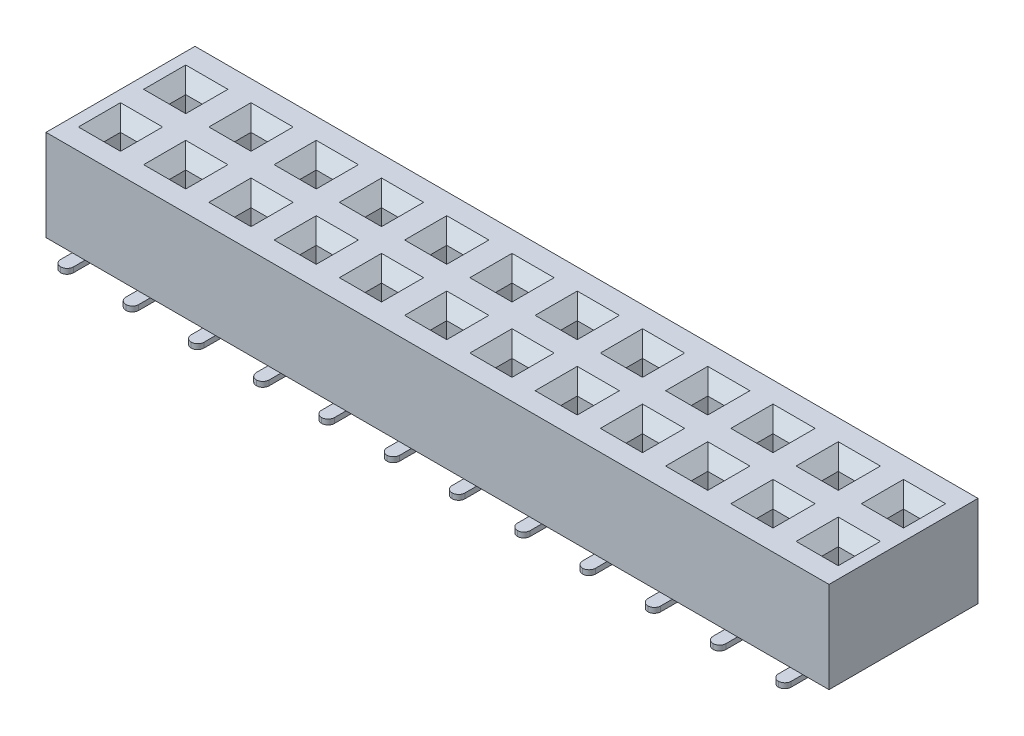
from build123d import *

# Parameters (mm, degrees)
SKETCH1_W                  = 30.48
SKETCH1_H                  = 5.8
BOSS_EXTRUDE1_DEPTH        = 3.55
SKETCH2_W                  = 0.64
SKETCH2_H                  = 0.64
CUT_EXTRUDE1_DEPTH         = 31.822765937
CHAMFER1_SIZE              = 0.5
LPATTERN1_COUNT            = 12
LPATTERN1_PITCH            = 2.54
LPATTERN1_COUNT_DIR2       = 2
LPATTERN1_PITCH_DIR2       = 2.54
CHAMFER1_OF_LPATTERN1_SIZE = 0.5
SKETCH3_W                  = 0.5
SKETCH3_H                  = 2.01
BOSS_EXTRUDE2_DEPTH        = 0.2
FILLET1_R                  = 0.25
LPATTERN2_COUNT            = 12
LPATTERN2_PITCH            = 2.54
FILLET1_OF_LPATTERN2_R     = 0.25


with BuildPart() as part:
    # Sketch1 → Boss-Extrude1 (new body)
    with BuildSketch(Plane(origin=(0, 0, 0), x_dir=(1, 0, 0), z_dir=(0, 1, 0))):
        with Locations((15.24, 0)):
            Rectangle(SKETCH1_W, SKETCH1_H)
    extrude(amount=BOSS_EXTRUDE1_DEPTH)

    # Sketch2 → Cut-Extrude1 (cut, through all)
    with BuildSketch(Plane(origin=(0, 3.55, 0), x_dir=(1, 0, 0), z_dir=(0, 1, 0))):
        with Locations((1.27, 1.27)):
            Rectangle(SKETCH2_W, SKETCH2_H)
    cut_extrude1 = extrude(amount=-CUT_EXTRUDE1_DEPTH, mode=Mode.SUBTRACT)

    # Chamfer1
    chamfer1_edges = [part.edges().sort_by_distance(p)[0] for p in [
        (0.95, 3.55, -1.27),
        (1.27, 3.55, -0.95),
        (1.59, 3.55, -1.27),
        (1.27, 3.55, -1.59),
    ]]
    chamfer(chamfer1_edges, length=CHAMFER1_SIZE)

    # LPattern1: Cut-Extrude1 12 × 2
    with Locations(*[(i * LPATTERN1_PITCH, 0, j * LPATTERN1_PITCH_DIR2) for i in range(LPATTERN1_COUNT) for j in range(LPATTERN1_COUNT_DIR2) if (i, j) != (0, 0)]):
        add(cut_extrude1, mode=Mode.SUBTRACT)

    # Chamfer1 of LPattern1
    chamfer1_of_lpattern1_edges = [part.edges().sort_by_distance(p)[0] for p in [
        (0.95, 3.55, 1.27),
        (1.27, 3.55, 1.59),
        (1.59, 3.55, 1.27),
        (1.27, 3.55, 0.95),
        (3.49, 3.55, -1.27),
        (3.81, 3.55, -0.95),
        (4.13, 3.55, -1.27),
        (3.81, 3.55, -1.59),
        (3.49, 3.55, 1.27),
        (3.81, 3.55, 1.59),
        (4.13, 3.55, 1.27),
        (3.81, 3.55, 0.95),
        (6.03, 3.55, -1.27),
        (6.35, 3.55, -0.95),
        (6.67, 3.55, -1.27),
        (6.35, 3.55, -1.59),
        (6.03, 3.55, 1.27),
        (6.35, 3.55, 1.59),
        (6.67, 3.55, 1.27),
        (6.35, 3.55, 0.95),
        (8.57, 3.55, -1.27),
        (8.89, 3.55, -0.95),
        (9.21, 3.55, -1.27),
        (8.89, 3.55, -1.59),
        (8.57, 3.55, 1.27),
        (8.89, 3.55, 1.59),
        (9.21, 3.55, 1.27),
        (8.89, 3.55, 0.95),
        (11.11, 3.55, -1.27),
        (11.43, 3.55, -0.95),
        (11.75, 3.55, -1.27),
        (11.43, 3.55, -1.59),
        (11.11, 3.55, 1.27),
        (11.43, 3.55, 1.59),
        (11.75, 3.55, 1.27),
        (11.43, 3.55, 0.95),
        (13.65, 3.55, -1.27),
        (13.97, 3.55, -0.95),
        (14.29, 3.55, -1.27),
        (13.97, 3.55, -1.59),
        (13.65, 3.55, 1.27),
        (13.97, 3.55, 1.59),
        (14.29, 3.55, 1.27),
        (13.97, 3.55, 0.95),
        (16.19, 3.55, -1.27),
        (16.51, 3.55, -0.95),
        (16.83, 3.55, -1.27),
        (16.51, 3.55, -1.59),
        (16.19, 3.55, 1.27),
        (16.51, 3.55, 1.59),
        (16.83, 3.55, 1.27),
        (16.51, 3.55, 0.95),
        (18.73, 3.55, -1.27),
        (19.05, 3.55, -0.95),
        (19.37, 3.55, -1.27),
        (19.05, 3.55, -1.59),
        (18.73, 3.55, 1.27),
        (19.05, 3.55, 1.59),
        (19.37, 3.55, 1.27),
        (19.05, 3.55, 0.95),
        (21.27, 3.55, -1.27),
        (21.59, 3.55, -0.95),
        (21.91, 3.55, -1.27),
        (21.59, 3.55, -1.59),
        (21.27, 3.55, 1.27),
        (21.59, 3.55, 1.59),
        (21.91, 3.55, 1.27),
        (21.59, 3.55, 0.95),
        (23.81, 3.55, -1.27),
        (24.13, 3.55, -0.95),
        (24.45, 3.55, -1.27),
        (24.13, 3.55, -1.59),
        (23.81, 3.55, 1.27),
        (24.13, 3.55, 1.59),
        (24.45, 3.55, 1.27),
        (24.13, 3.55, 0.95),
        (26.35, 3.55, -1.27),
        (26.67, 3.55, -0.95),
        (26.99, 3.55, -1.27),
        (26.67, 3.55, -1.59),
        (26.35, 3.55, 1.27),
        (26.67, 3.55, 1.59),
        (26.99, 3.55, 1.27),
        (26.67, 3.55, 0.95),
        (28.89, 3.55, -1.27),
        (29.21, 3.55, -0.95),
        (29.53, 3.55, -1.27),
        (29.21, 3.55, -1.59),
        (28.89, 3.55, 1.27),
        (29.21, 3.55, 1.59),
        (29.53, 3.55, 1.27),
        (29.21, 3.55, 0.95),
    ]]
    chamfer(chamfer1_of_lpattern1_edges, length=CHAMFER1_OF_LPATTERN1_SIZE)

    # Sketch3 → Boss-Extrude2 (add)
    with BuildSketch(Plane.XZ):
        with Locations((1.27, 2.595)):
            Rectangle(SKETCH3_W, SKETCH3_H)
        with Locations((1.27, -2.595)):
            Rectangle(SKETCH3_W, SKETCH3_H)
    boss_extrude2 = extrude(amount=BOSS_EXTRUDE2_DEPTH)

    # Fillet1
    fillet1_edges = [part.edges().sort_by_distance(p)[0] for p in [
        (1.02, -0.1, -3.6),
        (1.52, -0.1, -3.6),
        (1.02, -0.1, 3.6),
        (1.52, -0.1, 3.6),
    ]]
    fillet(fillet1_edges, radius=FILLET1_R - 0.0001)  # a hair under: the kernel refuses the full size

    # LPattern2: Boss-Extrude2 ×12
    with Locations(*[(i * LPATTERN2_PITCH, 0, 0) for i in range(1, LPATTERN2_COUNT)]):
        add(boss_extrude2)

    # Fillet1 of LPattern2
    fillet1_of_lpattern2_edges = [part.edges().sort_by_distance(p)[0] for p in [
        (3.56, -0.1, -3.6),
        (4.06, -0.1, -3.6),
        (3.56, -0.1, 3.6),
        (4.06, -0.1, 3.6),
        (6.1, -0.1, -3.6),
        (6.6, -0.1, -3.6),
        (6.1, -0.1, 3.6),
        (6.6, -0.1, 3.6),
        (8.64, -0.1, -3.6),
        (9.14, -0.1, -3.6),
        (8.64, -0.1, 3.6),
        (9.14, -0.1, 3.6),
        (11.18, -0.1, -3.6),
        (11.68, -0.1, -3.6),
        (11.18, -0.1, 3.6),
        (11.68, -0.1, 3.6),
        (13.72, -0.1, -3.6),
        (14.22, -0.1, -3.6),
        (13.72, -0.1, 3.6),
        (14.22, -0.1, 3.6),
        (16.26, -0.1, -3.6),
        (16.76, -0.1, -3.6),
        (16.26, -0.1, 3.6),
        (16.76, -0.1, 3.6),
        (18.8, -0.1, -3.6),
        (19.3, -0.1, -3.6),
        (18.8, -0.1, 3.6),
        (19.3, -0.1, 3.6),
        (21.34, -0.1, -3.6),
        (21.84, -0.1, -3.6),
        (21.34, -0.1, 3.6),
        (21.84, -0.1, 3.6),
        (23.88, -0.1, -3.6),
        (24.38, -0.1, -3.6),
        (23.88, -0.1, 3.6),
        (24.38, -0.1, 3.6),
        (26.42, -0.1, -3.6),
        (26.92, -0.1, -3.6),
        (26.42, -0.1, 3.6),
        (26.92, -0.1, 3.6),
        (28.96, -0.1, -3.6),
        (29.46, -0.1, -3.6),
        (28.96, -0.1, 3.6),
        (29.46, -0.1, 3.6),
    ]]
    fillet(fillet1_of_lpattern2_edges, radius=FILLET1_OF_LPATTERN2_R - 0.0001)  # a hair under: the kernel refuses the full size


solid = part.part
